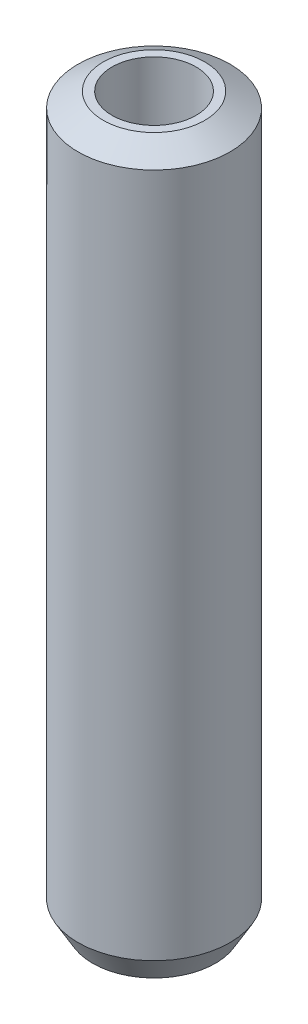
from build123d import *
from OCP.BRepFilletAPI import BRepFilletAPI_MakeChamfer

# Parameters (mm, degrees)
SKETCH1_R           = 12.5
BOSS_EXTRUDE1_DEPTH = 119.137422336
SKETCH2_R           = 6.908398906
CUT_EXTRUDE1_DEPTH  = 121.441792584
CHAMFER1_SIZE       = 2.401998899
CHAMFER1_SIZE2      = 4.160384133


with BuildPart() as part:
    # Sketch1 → Boss-Extrude1 (new body)
    with BuildSketch(Plane(origin=(0, 0, 0), x_dir=(1, 0, 0), z_dir=(0, 1, 0))):
        Circle(SKETCH1_R)
    extrude(amount=BOSS_EXTRUDE1_DEPTH)

    # Sketch2 → Cut-Extrude1 (cut, through all)
    with BuildSketch(Plane(origin=(0, 0, 0), x_dir=(1, 0, 0), z_dir=(0, 1, 0))):
        Circle(SKETCH2_R)
    extrude(amount=CUT_EXTRUDE1_DEPTH, mode=Mode.SUBTRACT)

    # Chamfer1: one chamfer whose edges measure the first distance from different faces: ONE call of the kernel's chamfer builder (chamfer() names one face for all edges)
    chamfer1_edges_1 = [part.edges().sort_by_distance(p)[0] for p in [
        (-12.5, 119.137422336, 0),
    ]]
    chamfer1_side_1 = [part.faces().sort_by_distance(p)[0] for p in [
        (-12.5, 59.568711168, 0),
    ]]
    chamfer1_edges_2 = [part.edges().sort_by_distance(p)[0] for p in [
        (-12.5, 0, 0),
    ]]
    chamfer1_side_2 = [part.faces().sort_by_distance(p)[0] for p in [
        (-12.146446609, 0, 0),
    ]]
    chamfer1 = BRepFilletAPI_MakeChamfer(part.part.solid().wrapped)
    for e in chamfer1_edges_1:
        chamfer1.Add(CHAMFER1_SIZE, CHAMFER1_SIZE2, e.wrapped, chamfer1_side_1[0].wrapped)  # the first distance lies on this face
    for e in chamfer1_edges_2:
        chamfer1.Add(CHAMFER1_SIZE, CHAMFER1_SIZE2, e.wrapped, chamfer1_side_2[0].wrapped)  # the first distance lies on this face
    add(Compound.cast(chamfer1.Shape()), mode=Mode.REPLACE)


solid = part.part
